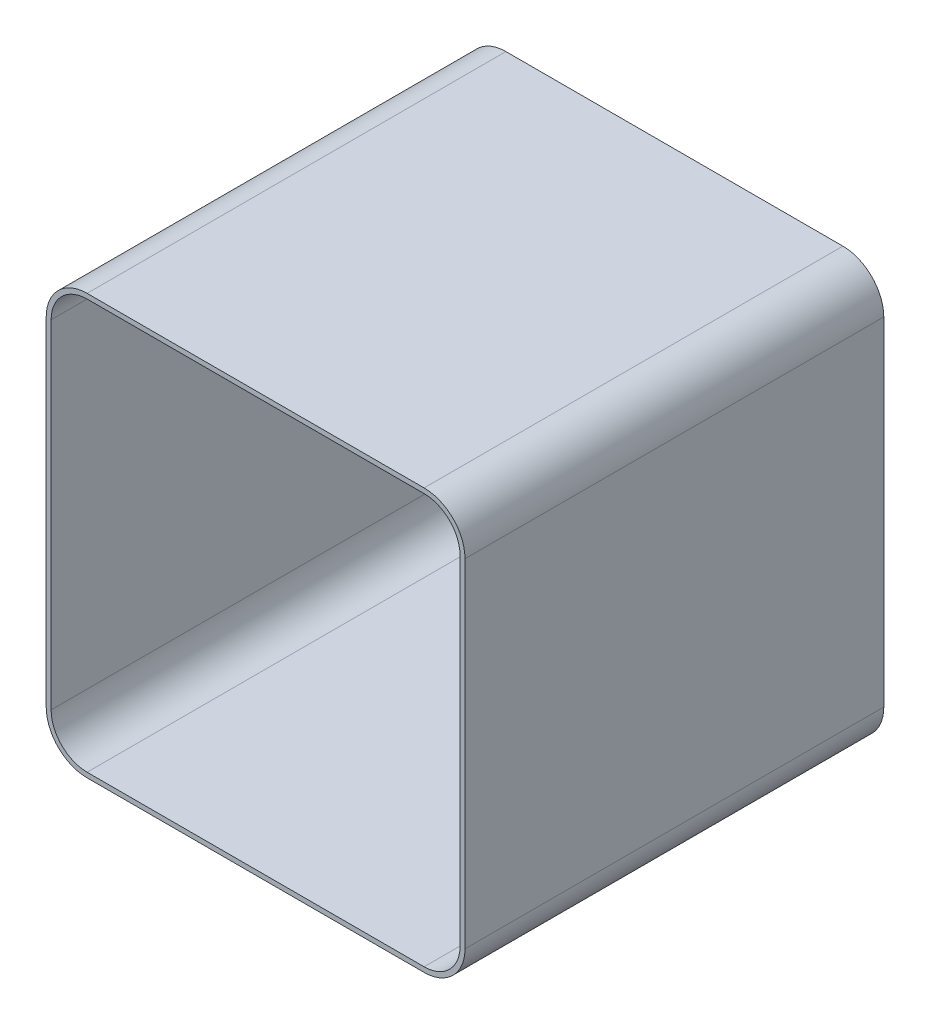
from build123d import *

# Parameters (mm, degrees)
EXTRUDE_THIN1_DEPTH = 512


with BuildPart() as part:
    # Sketch1 → Extrude-Thin1 (new body)
    with BuildSketch(Plane.XY):
        with BuildLine():
            Line((44, -6), (456, -6))
            ThreePointArc((456, -6), (491.355339059, 8.644660941), (506, 44))
            Line((506, 44), (506, 457))
            ThreePointArc((506, 457), (491.355339059, 492.355339059), (456, 507))
            Line((456, 507), (44, 507))
            ThreePointArc((44, 507), (8.644660941, 492.355339059), (-6, 457))
            Line((-6, 457), (-6, 44))
            ThreePointArc((-6, 44), (8.644660941, 8.644660941), (44, -6))
        make_face()
        with BuildLine():
            Line((44, 0), (456, 0))
            ThreePointArc((456, 0), (487.112698372, 12.887301628), (500, 44))
            Line((500, 44), (500, 457))
            ThreePointArc((500, 457), (487.112698372, 488.112698372), (456, 501))
            Line((456, 501), (44, 501))
            ThreePointArc((44, 501), (12.887301628, 488.112698372), (0, 457))
            Line((0, 457), (0, 44))
            ThreePointArc((0, 44), (12.887301628, 12.887301628), (44, 0))
        make_face(mode=Mode.SUBTRACT)
    extrude(amount=-EXTRUDE_THIN1_DEPTH)


solid = part.part
